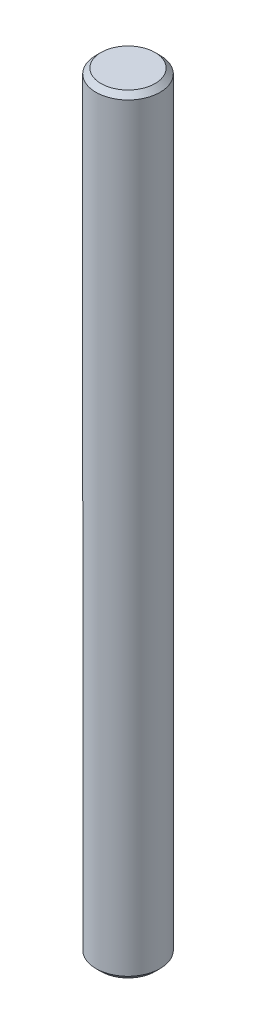
from build123d import *

# Parameters (mm, degrees)
BAR_FACE_R        = 3.175
BAR_EXTRUDE_DEPTH = 76.2
CHAMFER2_SIZE     = 0.5


with BuildPart() as part:
    # Bar face → Bar extrude (new body)
    with BuildSketch(Plane(origin=(0, 0, 0), x_dir=(1, 0, 0), z_dir=(0, 1, 0))):
        Circle(BAR_FACE_R)
    extrude(amount=BAR_EXTRUDE_DEPTH)

    # Chamfer2
    chamfer2_edges = [part.edges().sort_by_distance(p)[0] for p in [
        (-3.175, 76.2, 0),
        (-3.175, 0, 0),
    ]]
    chamfer(chamfer2_edges, length=CHAMFER2_SIZE)


solid = part.part
